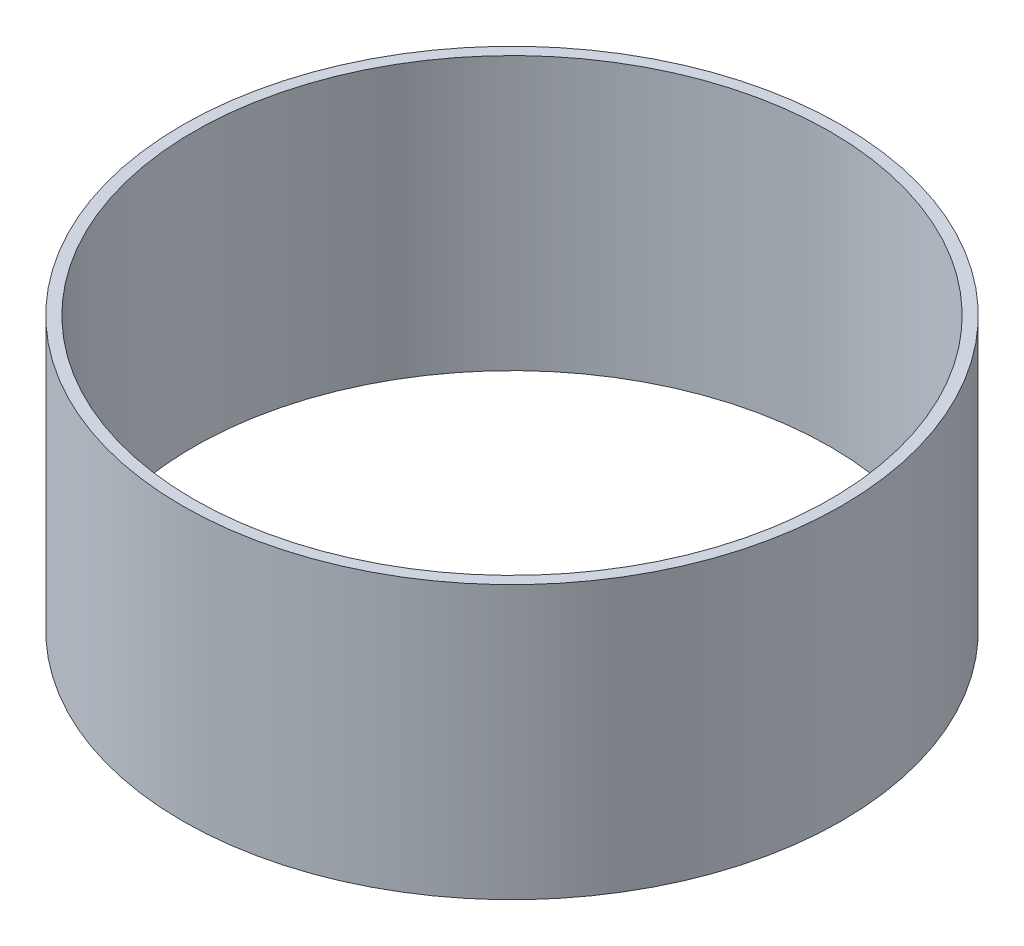
from build123d import *

# Parameters (mm, degrees)
SKETCH1_R           = 92.075
SKETCH1_R_2         = 88.9
BOSS_EXTRUDE1_DEPTH = 38.1


with BuildPart() as part:
    # Sketch1 → Boss-Extrude1 (new, symmetric)
    with BuildSketch(Plane(origin=(0, 0, 0), x_dir=(1, 0, 0), z_dir=(0, 1, 0))):
        Circle(SKETCH1_R)
        Circle(SKETCH1_R_2, mode=Mode.SUBTRACT)
    extrude(amount=BOSS_EXTRUDE1_DEPTH, both=True)


solid = part.part
